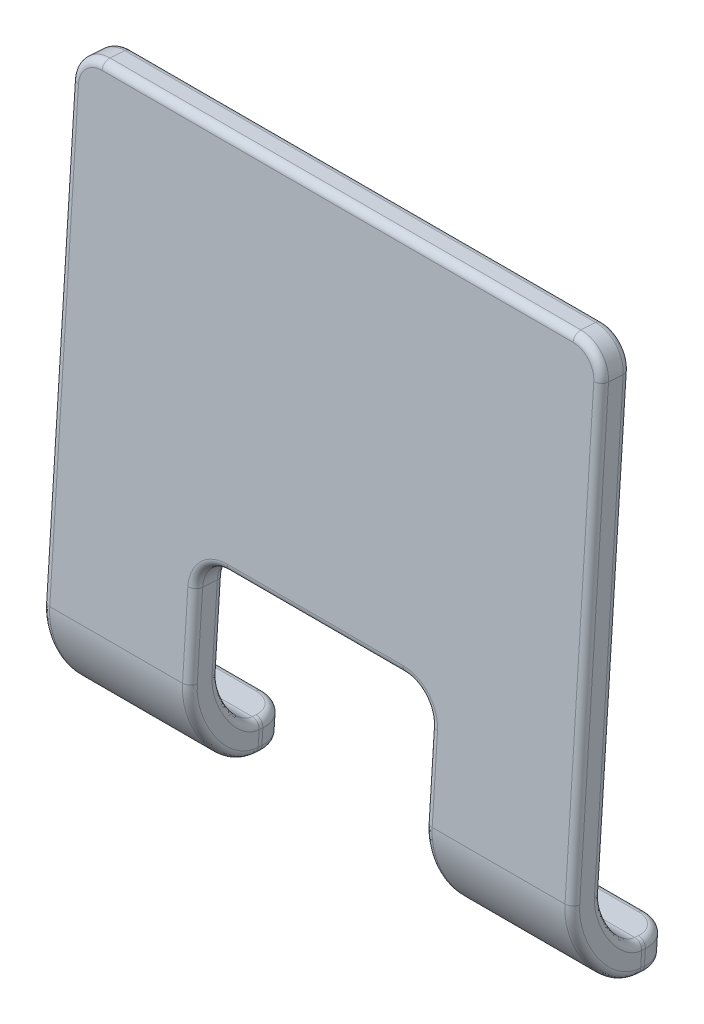
from build123d import *

# Parameters (mm, degrees)
BOSS_EXTRUDE1_DEPTH = 25.4
SWEEP1_START        = -104.084300367
SWEEP1_DEPTH        = 127
FILLET5_R           = 25.4
FILLET6_R           = 6.35


# Read off the part's stored shape, not the designer's step: Sweep1
with BuildPart() as part:
    # Sketch1 → Boss-Extrude1 (new body)
    with BuildSketch(Plane(origin=(0, -1.310151077, -39.966934858), x_dir=(1, 0, 0), z_dir=(5.020513703918685e-14, 0.06549137294531172, 0.9978531355213242))):
        Polygon((352.093232306, -220.551768792), (225.093232306, -220.551768792), (225.093232306, -125.253441458), (22.915699633, -125.253441458), (22.915699633, -220.551768792), (-104.084300367, -220.551768792), (-104.084300367, 182.829090471), (352.093232306, 182.829090471), align=None)
    extrude(amount=BOSS_EXTRUDE1_DEPTH)

    # Sweep1 outline → Sweep1 (add)
    with BuildSketch(Plane.YZ.offset(SWEEP1_START)):
        with BuildLine():
            Line((-276.446001686, -88.72759278), (-274.574585704, -60.213939432))
            add(Edge.make_bspline(
                [(-274.574585704, -60.213939432), (-274.489185506, -58.91274739), (-274.162556504, -57.568218751), (-273.396406486, -55.565838755), (-273.095211422, -54.900844742), (-272.426365525, -53.592147936), (-272.058713231, -52.948443258), (-270.896009355, -51.0773199), (-270.064152044, -49.938703592), (-268.311742617, -47.773758231), (-267.39042458, -46.747374812), (-264.408348953, -43.685581706), (-262.345691213, -41.875761123), (-257.986579213, -38.489940905), (-255.68944333, -36.914177066), (-250.635892103, -33.836945779), (-248.254998534, -32.560300496), (-244.570732422, -30.819527427), (-243.323852296, -30.268118112), (-240.731974284, -29.21517951), (-239.386970797, -28.713647927), (-236.53228082, -27.750615639), (-235.072822636, -27.310380735), (-232.160901445, -26.552248253), (-230.708432873, -26.234348303), (-226.459205376, -25.520726174), (-223.768492794, -25.366487454), (-221.38842511, -25.522696714)],
                knots=[0.297328704, 0.297328704, 0.297328704, 0.297328704, 0.341507603, 0.341507603, 0.363597052, 0.363597052, 0.385686502, 0.385686502, 0.429741534, 0.429741534, 0.473796567, 0.473796567, 0.561420603, 0.561420603, 0.649044639, 0.649044639, 0.73659745, 0.73659745, 0.780373855, 0.780373855, 0.82415026, 0.82415026, 0.868112695, 0.868112695, 0.91207513, 0.91207513, 1, 1, 1, 1], degree=3))
            Line((-221.38842511, -25.522696714), (-219.724944238, -0.177227072))
            add(Edge.make_bspline(
                [(-299.920055346, -58.550458559), (-299.631969935, -54.161072821), (-298.626426, -50.428224189), (-296.748678422, -45.520615339), (-296.073637535, -44.04812785), (-294.682631702, -41.326417356), (-293.960884138, -40.070501564), (-291.815657129, -36.618216235), (-290.342988442, -34.62025755), (-287.518422305, -31.130758445), (-286.042505559, -29.493752371), (-281.696688589, -25.031761686), (-278.72294033, -22.434503875), (-272.771126762, -17.811596602), (-269.630997785, -15.665033251), (-263.11548, -11.697574555), (-259.876986744, -9.959048486), (-255.036175627, -7.671821273), (-253.34997231, -6.925235526), (-249.825623705, -5.493485006), (-248.009143902, -4.815950134), (-244.146296024, -3.512815157), (-242.107639519, -2.895178256), (-237.925418657, -1.806317235), (-235.765938278, -1.328008865), (-228.964610321, -0.185782956), (-224.4275196, 0.131413648), (-219.724944238, -0.177227072)],
                knots=[0.297328704, 0.297328704, 0.297328704, 0.297328704, 0.341507603, 0.341507603, 0.363597052, 0.363597052, 0.385686502, 0.385686502, 0.429741534, 0.429741534, 0.473796567, 0.473796567, 0.561420603, 0.561420603, 0.649044639, 0.649044639, 0.73659745, 0.73659745, 0.780373855, 0.780373855, 0.82415026, 0.82415026, 0.868112695, 0.868112695, 0.91207513, 0.91207513, 1, 1, 1, 1], degree=3))
            Line((-299.920055346, -58.550458559), (-301.791471328, -87.064111907))
            Line((-301.791471328, -87.064111907), (-276.446001686, -88.72759278))
        make_face()
    sweep1 = extrude(amount=SWEEP1_DEPTH)

    # Mirror2: Sweep1 across plane
    add(sweep1.mirror(Plane.ZY.offset(-124.004465969)))

    # Fillet5
    fillet5_edges = [part.edges().sort_by_distance(p)[0] for p in [
        (-104.084300367, 181.958170551, -39.267928186),
        (22.915699633, -125.462949933, -19.09118019),
        (225.093232306, -125.462949933, -19.09118019),
        (352.093232306, 181.958170551, -39.267928186),
        (22.915699633, -289.118736507, -87.895852343),
        (-104.084300367, -289.118736507, -87.895852343),
        (352.093232305, -289.118736507, -87.895852344),
        (225.093232305, -289.118736507, -87.895852344),
    ]]
    fillet(fillet5_edges, radius=FILLET5_R)

    # Fillet6
    fillet6_edges = [part.edges().sort_by_distance(p)[0] for p in [
        (352.093232306, -32.803732319, -37.899939424),
        (22.915699633, -186.514292561, -27.811565426),
        (-104.084300367, -253.192989844, -35.394034391),
        (22.915699633, -253.192989844, -35.394034391),
        (22.915699633, -253.192989844, -35.394034391),
        (-104.084300367, -253.192989844, -35.394034391),
        (352.093232305, -253.192989844, -35.394034391),
        (225.093232305, -253.192989844, -35.394034391),
        (225.093232305, -253.192989844, -35.394034391),
        (352.093232305, -253.192989844, -35.394034391),
        (-104.084300367, -32.803732319, -37.899939424),
        (-104.084300367, -31.140251446, -12.554469782),
        (124.004465969, 181.126430114, -51.940663007),
        (225.093232306, -186.514292561, -27.811565426),
        (124.004465969, -126.29469037, -31.763915011),
        (344.653744548, 173.702913928, -51.45344074),
        (-96.644812609, 173.702913928, -51.45344074),
        (124.004465969, 182.789910987, -26.595193365),
        (124.004465969, -124.631209497, -6.418445369),
        (225.093232306, -184.850811688, -2.466095784),
        (344.653744548, 175.366394801, -26.107971098),
        (-96.644812609, 175.366394801, -26.107971098),
        (288.593232306, -276.446001686, -88.72759278),
        (288.593232306, -301.791471328, -87.064111907),
        (225.093232305, -300.024022901, -60.134550412),
        (352.093232305, -300.024022901, -60.134550412),
        (232.532720063, -301.304249061, -79.640595721),
        (344.653744548, -301.304249061, -79.640595721),
        (352.093232305, -274.678553259, -61.798031285),
        (225.093232305, -274.678553259, -61.798031285),
        (232.532720063, -275.958779419, -81.304076594),
        (344.653744548, -275.958779419, -81.304076594),
        (-40.584300367, -276.446001686, -88.72759278),
        (-40.584300367, -301.791471328, -87.064111907),
        (22.915699633, -274.678553259, -61.798031285),
        (-104.084300367, -274.678553259, -61.798031285),
        (15.476211875, -275.958779419, -81.304076594),
        (-96.644812609, -275.958779419, -81.304076594),
        (-104.084300367, -300.024022901, -60.134550412),
        (22.915699633, -300.024022901, -60.134550412),
        (15.476211875, -301.304249061, -79.640595721),
        (-96.644812609, -301.304249061, -79.640595721),
        (217.653744548, -133.718206556, -31.276692744),
        (217.653744548, -132.054725683, -5.931223101),
        (30.355187391, -133.718206556, -31.276692744),
        (30.355187391, -132.054725683, -5.931223101),
        (22.915699633, -184.850811688, -2.466095784),
        (352.093232306, -31.140251446, -12.554469782),
    ]]
    fillet(fillet6_edges, radius=FILLET6_R)


solid = part.part
